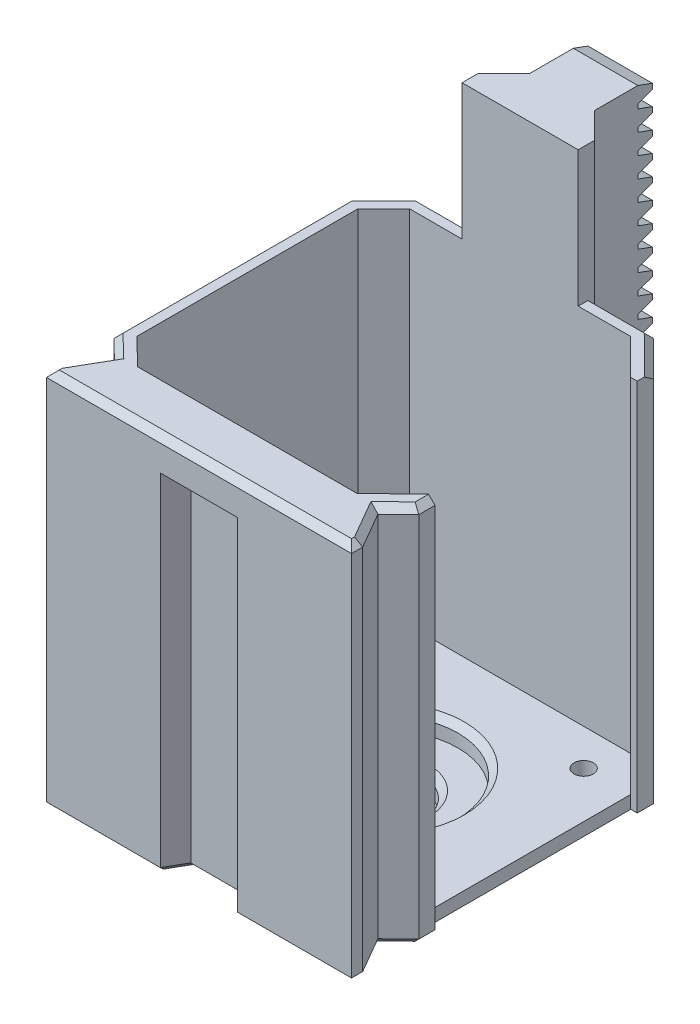
from build123d import *

# Parameters (mm, degrees)
SKETCH1_R                                     = 1.5
SKETCH1_R_2                                   = 11.5
MOUNT_FACE_EXTRUDE_DEPTH                      = 3
BRACKET_MOUNT_HOLE_CHAMFER_SIZE               = 0.75
MAIN_BODY_EXTRUDE_DEPTH                       = 59
FRONT_FACE_FILL_IN_EXTRUDE_DEPTH              = 3
LIMIT_TAB_DEPTH                               = 54
RACK_EXTRUDE_DEPTH                            = 5
RACK_CHAMFER_SIZE                             = 4
RACK_SUPPORT_BASE_EXTRUDE_DEPTH               = 20.999999981
FACE_START                                    = 4
SKETCH27_R                                    = 13.6
SKETCH27_R_2                                  = 11.5
SKETCH27_R_3                                  = 6
FACE_COSMETIC_RING_EXTRUDE_DEPTH              = 4
FACE_COSMETIC_RING_MAIN_CHAMFER_SIZE          = 4
FACE_COSMETIC_RING_MAIN_THROUGH_HOLE_CHA_SIZE = 1
FRONT_BACK_FACE_CHAMFER_SIZE                  = 1


with BuildPart() as part:
    # Sketch1 → Mount Face Extrude (new body)
    with BuildSketch(Plane(origin=(0, 0, 0), x_dir=(1, 0, 0), z_dir=(0, 1, 0))):
        Polygon((-21.15, 17.15), (-17.15, 21.15), (17.15, 21.15), (21.15, 17.15), (21.15, -17.15), (17, -21.15), (-17, -21.15), (-21.15, -17.15), align=None)
        with Locations(Location((-15.5, 15.5, 0), (0, 0, 270))):
            Circle(SKETCH1_R, mode=Mode.SUBTRACT)
        with Locations(Location((15.5, 15.5, 0), (0, 0, 270))):
            Circle(SKETCH1_R, mode=Mode.SUBTRACT)
        with Locations(Location((15.5, -15.5, 0), (0, 0, 270))):
            Circle(SKETCH1_R, mode=Mode.SUBTRACT)
        with Locations(Location((-15.5, -15.5, 0), (0, 0, 270))):
            Circle(SKETCH1_R, mode=Mode.SUBTRACT)
        with Locations(Location((0, 0, 0), (0, 0, 270))):
            Circle(SKETCH1_R_2, mode=Mode.SUBTRACT)
    extrude(amount=MOUNT_FACE_EXTRUDE_DEPTH)

    # Bracket Mount Hole Chamfer
    bracket_mount_hole_chamfer_edges = [part.edges().sort_by_distance(p)[0] for p in [
        (-15.5, 0, -17),
        (15.5, 0, -17),
        (15.5, 0, 14),
        (-15.5, 0, 14),
    ]]
    chamfer(bracket_mount_hole_chamfer_edges, length=BRACKET_MOUNT_HOLE_CHAMFER_SIZE)

    # Sketch5 → Main Body Extrude (add)
    with BuildSketch(Plane(origin=(0, 0, 0), x_dir=(1, 0, 0), z_dir=(0, 1, 0))):
        Polygon((21.15, -17.15), (22.65, -15.704216867), (23.65, -15.704216867), (23.65, -18.212588103), (20.420896185, -21.324977322), (23.65, -26.917949192), (23.65, -28.65), (-23.65, -28.65), (-23.65, -26.917949192), (-20.420896185, -21.324977322), (-23.65, -18.212588103), (-23.65, 14.65), (-23.65, 18.185533906), (-18.185533906, 23.65), (18.185533906, 23.65), (23.65, 18.185533906), (23.65, 15.65), (22.65, 15.65), (21.15, 17.15), (17.15, 21.15), (-17.15, 21.15), (-21.15, 17.15), (-21.15, -17.15), (-17, -21.15), (17, -21.15), align=None)
    extrude(amount=MAIN_BODY_EXTRUDE_DEPTH)

    # Sketch37 → Front Face Fill in Extrude (add)
    with BuildSketch(Plane.XZ):
        Polygon((21.15, -17.15), (22.65, -15.65), (22.65, 15.704216867), (21.15, 17.15), align=None)
    extrude(amount=-FRONT_FACE_FILL_IN_EXTRUDE_DEPTH)

    # Sketch39 → Limit Tab (cut)
    with BuildSketch(Plane.XZ):
        Polygon((-6, 28.65), (-4.267949192, 25.65), (4.267949192, 25.65), (6, 28.65), align=None)
    extrude(amount=-LIMIT_TAB_DEPTH, mode=Mode.SUBTRACT)

    # Sketch13 → Rack Extrude (add, symmetric)
    with BuildSketch(Plane(origin=(0, 0, 0), x_dir=(0, 0, -1), z_dir=(1, 0, 0))):
        Polygon((36.65, 6.9244359), (36.65, 6.08158005), (34.400000137, 5.262647), (34.400000137, 4.6017763), (36.65, 3.78284325), (36.65, 2.9399874), (34.400000137, 2.12105435), (34.400000137, 1.46018365), (36.65, 0.6412506), (36.65, 0), (23.65, 0), (23.65, 80), (34.400000137, 79.9999999), (36.65, 79.18106685), (36.65, 78.338211), (34.400000137, 77.51927795), (34.400000137, 76.85840725), (36.65, 76.0394742), (36.65, 75.19661835), (34.400000137, 74.3776853), (34.400000137, 73.7168146), (36.65, 72.89788155), (36.65, 72.0550257), (34.400000137, 71.23609265), (34.400000137, 70.57522195), (36.65, 69.7562889), (36.65, 68.91343305), (34.400000137, 68.0945), (34.400000137, 67.4336293), (36.65, 66.61469625), (36.65, 65.7718404), (34.400000137, 64.95290735), (34.400000137, 64.29203665), (36.65, 63.4731036), (36.65, 62.63024775), (34.400000137, 61.8113147), (34.400000137, 61.150444), (36.65, 60.33151095), (36.65, 59.4886551), (34.400000137, 58.66972205), (34.400000137, 58.00885135), (36.65, 57.1899183), (36.65, 56.34706245), (34.400000137, 55.5281294), (34.400000137, 54.8672587), (36.65, 54.04832565), (36.65, 53.2054698), (34.400000137, 52.38653675), (34.400000137, 51.72566605), (36.65, 50.906733), (36.65, 50.06387715), (34.400000137, 49.2449441), (34.400000137, 48.5840734), (36.65, 47.76514035), (36.65, 46.9222845), (34.400000137, 46.10335145), (34.400000137, 45.44248075), (36.65, 44.6235477), (36.65, 43.78069185), (34.400000137, 42.9617588), (34.400000137, 42.3008881), (36.65, 41.48195505), (36.65, 40.6390992), (34.400000137, 39.82016615), (34.400000137, 39.15929545), (36.65, 38.3403624), (36.65, 37.49750655), (34.400000137, 36.6785735), (34.400000137, 36.0177028), (36.65, 35.19876975), (36.65, 34.3559139), (34.400000137, 33.53698085), (34.400000137, 32.87611015), (36.65, 32.0571771), (36.65, 31.21432125), (34.400000137, 30.3953882), (34.400000137, 29.7345175), (36.65, 28.91558445), (36.65, 28.0727286), (34.400000137, 27.25379555), (34.400000137, 26.59292485), (36.65, 25.7739918), (36.65, 24.93113595), (34.400000137, 24.1122029), (34.400000137, 23.4513322), (36.65, 22.63239915), (36.65, 21.7895433), (34.400000137, 20.97061025), (34.400000137, 20.30973955), (36.65, 19.4908065), (36.65, 18.64795065), (34.400000137, 17.8290176), (34.400000137, 17.1681469), (36.65, 16.34921385), (36.65, 15.506358), (34.400000137, 14.68742495), (34.400000137, 14.02655425), (36.65, 13.2076212), (36.65, 12.36476535), (34.400000137, 11.5458323), (34.400000137, 10.8849616), (36.65, 10.06602855), (36.65, 9.2231727), (34.400000137, 8.40423965), (34.400000137, 7.74336895), align=None)
    extrude(amount=RACK_EXTRUDE_DEPTH, both=True)

    # Rack Chamfer
    rack_chamfer_edges = [part.edges().sort_by_distance(p)[0] for p in [
        (-5, 29.5, -23.65),
        (5, 29.5, -23.65),
    ]]
    chamfer(rack_chamfer_edges, length=RACK_CHAMFER_SIZE)

    # Sketch15 → Rack Support Base Extrude (add)
    with BuildSketch(Plane(origin=(0, 59, 0), x_dir=(1, 0, 0), z_dir=(0, 1, 0))):
        Polygon((-5, 27.65), (-9, 23.65), (-9, 21.15), (9, 21.15), (9, 23.65), (5, 27.65), align=None)
    extrude(amount=RACK_SUPPORT_BASE_EXTRUDE_DEPTH)

    # Sketch27 → Face Cosmetic Ring Extrude (add)
    # profile 1 of 2: a face of its own
    with BuildSketch(Plane(origin=(0, 0, 0), x_dir=(-1, 0, 0), z_dir=(0, -1, 0)).offset(FACE_START)):
        with Locations(Location((0, 0, 0), (0, 0, 90))):
            Circle(SKETCH27_R)
        with Locations(Location((0, 0, 0), (0, 0, 270))):
            Circle(SKETCH27_R_2, mode=Mode.SUBTRACT)
    # profile 2 of 2: a face of its own
    with BuildSketch(Plane(origin=(0, 0, 0), x_dir=(-1, 0, 0), z_dir=(0, -1, 0)).offset(FACE_START)):
        with Locations(Location((0, 0, 0), (0, 0, 270))):
            Circle(SKETCH27_R_2)
        with Locations(Location((0, 0, 0), (0, 0, 90))):
            Circle(SKETCH27_R_3, mode=Mode.SUBTRACT)
    extrude(amount=-FACE_COSMETIC_RING_EXTRUDE_DEPTH)

    # Face Cosmetic Ring Main Chamfer
    face_cosmetic_ring_main_chamfer_edges = [part.edges().sort_by_distance(p)[0] for p in [
        (0, 0, 13.6),
    ]]
    chamfer(face_cosmetic_ring_main_chamfer_edges, length=FACE_COSMETIC_RING_MAIN_CHAMFER_SIZE - 0.0001)  # a hair under: the kernel refuses the full size

    # Face Cosmetic Ring Main Through Hole Chamfer
    face_cosmetic_ring_main_through_hole_cha_edges = [part.edges().sort_by_distance(p)[0] for p in [
        (0, 3, -11.5),
        (0, 0, 6),
        (0, -4, 6),
    ]]
    chamfer(face_cosmetic_ring_main_through_hole_cha_edges, length=FACE_COSMETIC_RING_MAIN_THROUGH_HOLE_CHA_SIZE)

    # Front/Back Face Chamfer
    front_back_face_chamfer_edges = [part.edges().sort_by_distance(p)[0] for p in [
        (22.65, 0, 0.027108434),
        (-20.917766953, 59, -20.917766953),
        (-23.65, 59, 0.013527099),
        (-22.035448093, 59, 19.768782713),
        (-22.035448093, 59, 24.121463257),
        (-23.65, 59, 27.783974596),
        (0, 59, 28.65),
        (23.65, 59, 27.783974596),
        (22.035448093, 59, 24.121463257),
        (22.035448093, 59, 19.768782713),
        (23.65, 59, 16.958402485),
        (-13.592766953, 59, -23.65),
        (20.917766953, 59, -20.917766953),
        (13.592766953, 59, -23.65),
        (23.15, 0, -15.65),
        (23.15, 0, 15.704216867),
        (-13.592766953, 0, -23.65),
        (-7, 0, -25.65),
        (-20.917766953, 0, -20.917766953),
        (-23.65, 0, 0.013527099),
        (-22.035448093, 0, 19.768782713),
        (-22.035448093, 0, 24.121463257),
        (7, 0, -25.65),
        (-23.65, 0, 27.783974596),
        (13.592766953, 0, -23.65),
        (-14.825, 0, 28.65),
        (20.917766953, 0, -20.917766953),
        (-5.133974596, 0, 27.15),
        (23.65, 0, -16.917766953),
        (0, 0, 25.65),
        (5.133974596, 0, 27.15),
        (14.825, 0, 28.65),
        (23.65, 0, 27.783974596),
        (23.65, 0, 16.958402485),
        (22.035448093, 0, 24.121463257),
        (22.035448093, 0, 19.768782713),
    ]]
    chamfer(front_back_face_chamfer_edges, length=FRONT_BACK_FACE_CHAMFER_SIZE)


solid = part.part
